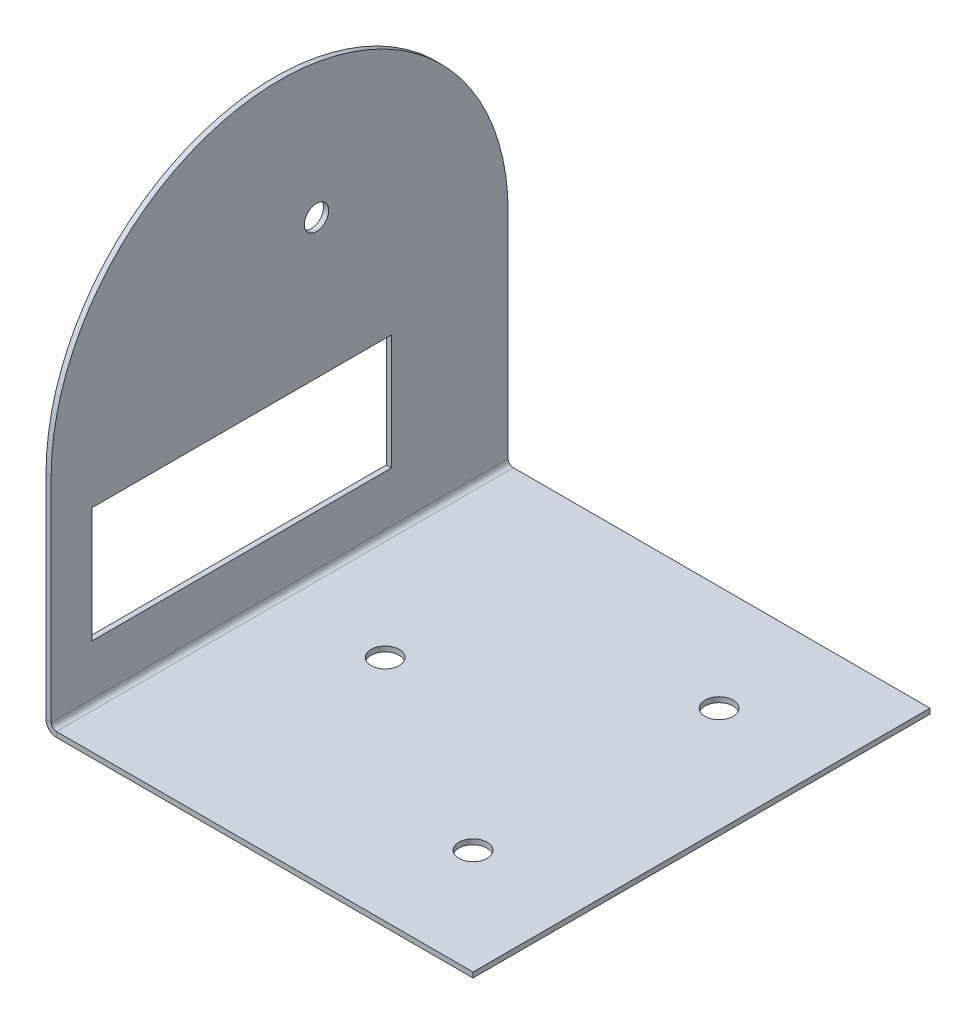
from build123d import *

# Parameters (mm, degrees)
SKETCH1_R                = 2
BASE_FLANGE3_DEPTH       = 0.7366
SKETCHED_START           = -64
SKETCHED_BEND1_OUTLINE_W = 0.7366
SKETCHED_BEND1_OUTLINE_H = 65
SKETCHED_BEND1_DEPTH     = 64.108877104
SKETCHED_START_2         = 0.168203781
SKETCHED_BEND1_2_DEPTH   = 0.525916755
SKETCHED_START_3         = -0.042479464
SKETCHED_BEND1_3_DEPTH   = 1.4732
SKETCHED_START_4         = -32.5
SKETCHED_BEND1_4_DEPTH   = 65
SKETCH28_W               = 42.572846016
SKETCH28_H               = 16.402646855
CUT_EXTRUDE8_DEPTH       = 83.088587536
CUT_EXTRUDE9_DEPTH       = 83.088587536
CUT_EXTRUDE9_DEPTH_BACK  = 83.088587536
SKETCH29_R               = 1.725
SKETCH30_W               = 30
SKETCH30_H               = 65
SKETCH30_R               = 2
TAB1_DEPTH               = 0.7366


with BuildPart() as part:
    # Base-Flange3: sheet metal written as solids
    # Sketch1 → Base-Flange3 (new body)
    with BuildSketch(Plane(origin=(0, 0, 0), x_dir=(1, 0, 0), z_dir=(0, 1, 0))):
        with BuildLine():
            Line((-30.694120536, 32.5), (30.694120536, 32.5))
            Line((30.694120536, 32.5), (30.694120536, -32.5))
            Line((30.694120536, -32.5), (-30.694120536, -32.5))
            ThreePointArc((-30.694120536, -32.5), (-63.194120536, 0), (-30.694120536, 32.5))
        make_face()
        with Locations(Location((15.694120536, 0, 0), (0, 0, 270))):
            Circle(SKETCH1_R, mode=Mode.SUBTRACT)
    extrude(amount=-BASE_FLANGE3_DEPTH)

    # Sketched Bend1: read off the stored shape, not the designer's step
    # Sketched Bend1 outline → Sketched Bend1 (cut)
    with BuildSketch(Plane.YZ.offset(SKETCHED_START)):
        with Locations((-0.3683, 0)):
            Rectangle(SKETCHED_BEND1_OUTLINE_W, SKETCHED_BEND1_OUTLINE_H)
    extrude(amount=SKETCHED_BEND1_DEPTH, mode=Mode.SUBTRACT)

    # Sketched Bend1 2 outline → Sketched Bend1 2 (add)
    with BuildSketch(Plane.YZ.offset(SKETCHED_START_2)):
        with BuildLine():
            ThreePointArc((31.12586821, -32.5), (63.62586821, 0), (31.12586821, 32.5))
            Line((31.12586821, 32.5), (0, 32.5))
            Line((0, 32.5), (0, -32.5))
            Line((0, -32.5), (31.12586821, -32.5))
        make_face()
    extrude(amount=SKETCHED_BEND1_2_DEPTH)

    # Sketched Bend1 3 outline → Sketched Bend1 3 (add)
    with BuildSketch(Plane.YZ.offset(SKETCHED_START_3)):
        with BuildLine():
            ThreePointArc((31.12586821, -32.5), (63.62586821, 0), (31.12586821, 32.5))
            Line((31.12586821, 32.5), (0, 32.5))
            Line((0, 32.5), (0, -32.5))
            Line((0, -32.5), (31.12586821, -32.5))
        make_face()
    extrude(amount=SKETCHED_BEND1_3_DEPTH)

    # Sketched Bend1 4 outline → Sketched Bend1 4 (cut)
    with BuildSketch(Plane.XY.offset(SKETCHED_START_4)):
        with BuildLine():
            Line((0.694120536, 65), (0.694120536, 0.7366))
            ThreePointArc((0.694120536, 0.7366), (0.90986568, 0.215745144), (1.430720536, 0))
            Line((1.430720536, 0), (1.430720536, 65))
            Line((1.430720536, 65), (0.694120536, 65))
        make_face()
        with BuildLine():
            Line((-0.042479464, 0.7366), (-0.042479396, 65))
            Line((-0.042479396, 65), (-2, 65))
            Line((-2, 65), (-2, 0))
            Line((-2, 0), (0.108877104, 0))
            Line((0.108877104, 0), (0.108877104, -2))
            Line((0.108877104, -2), (32, -2))
            Line((32, -2), (32, -0.736599968))
            Line((32, -0.736599968), (1.430720536, -0.7366))
            ThreePointArc((1.430720536, -0.7366), (0.389010825, -0.30510971), (-0.042479464, 0.7366))
        make_face()
    extrude(amount=SKETCHED_BEND1_4_DEPTH, mode=Mode.SUBTRACT)

    # Sketch28 → Cut-Extrude8 (cut, through all)
    with BuildSketch(Plane.ZY.offset(9.729079464)):
        with Locations((5.381444798, 16.092801871)):
            Rectangle(SKETCH28_W, SKETCH28_H)
    extrude(amount=-CUT_EXTRUDE8_DEPTH, mode=Mode.SUBTRACT)

    # Sketch29 → Cut-Extrude9 (cut, two sides: drawn at the far end of the back side and taken through both)
    with BuildSketch(Plane.ZY.offset(9.729079464).offset(-CUT_EXTRUDE9_DEPTH_BACK)):
        with Locations(Location((-5.239369246, 44.083803898, 0), (0, 0, 270))):
            Circle(SKETCH29_R)
    extrude(amount=CUT_EXTRUDE9_DEPTH + CUT_EXTRUDE9_DEPTH_BACK, mode=Mode.SUBTRACT)

    # Tab1: sheet metal written as solids
    # Sketch30 → Tab1 (add)
    with BuildSketch(Plane(origin=(0, 0, 0), x_dir=(1, 0, 0), z_dir=(0, 1, 0))):
        with Locations((45.694120536, 0)):
            Rectangle(SKETCH30_W, SKETCH30_H)
        with Locations(Location((45.694120536, -17.5, 0), (0, 0, 270))):
            Circle(SKETCH30_R, mode=Mode.SUBTRACT)
        with Locations(Location((45.694120536, 17.5, 0), (0, 0, 270))):
            Circle(SKETCH30_R, mode=Mode.SUBTRACT)
    extrude(amount=-TAB1_DEPTH)


solid = part.part
